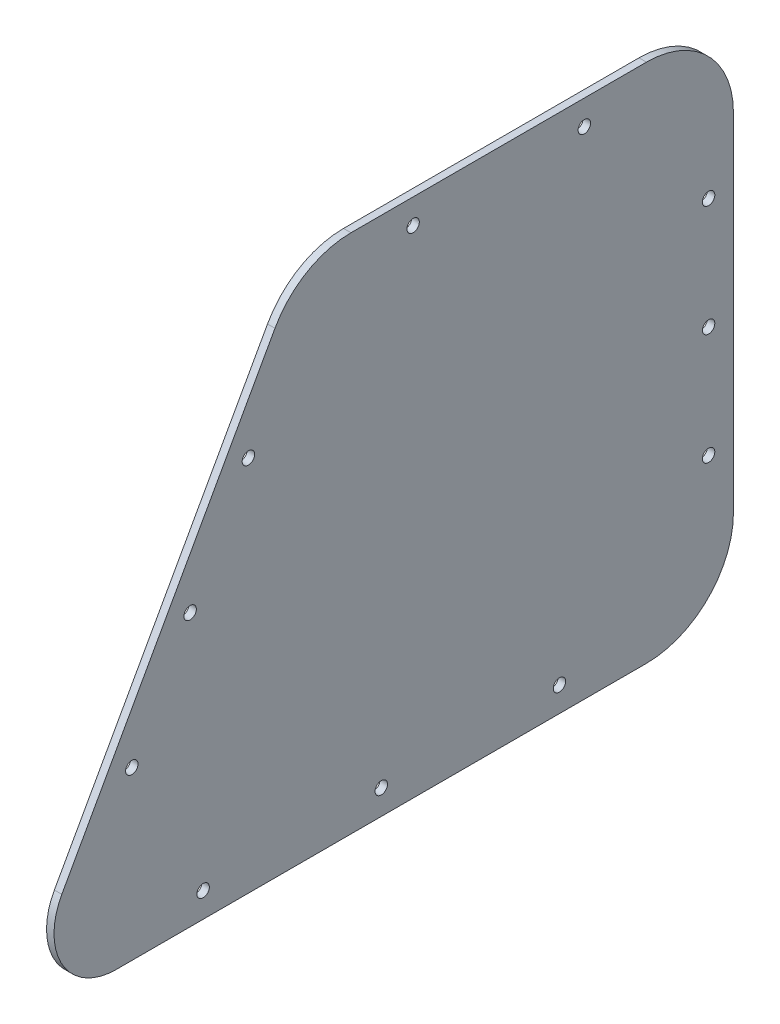
from build123d import *

# Parameters (mm, degrees)
BOSS_EXTRUDE1_DEPTH = 3
CUT_EXTRUDE1_REACH  = 242.652
SKETCH2_R           = 2.5


with BuildPart() as part:
    # Sketch1 → Boss-Extrude1 (new body)
    with BuildSketch(Plane(origin=(0, 0, 0), x_dir=(0, 0, -1), z_dir=(1, 0, 0))):
        with BuildLine():
            Line((-12.188515962, 194.5), (106.683660563, 194.5))
            ThreePointArc((106.683660563, 194.5), (131.432397904, 184.248737342), (141.683660563, 159.5))
            Line((141.683660563, 159.5), (141.683660563, 20))
            ThreePointArc((141.683660563, 20), (131.432397904, -4.748737342), (106.683660563, -15))
            Line((106.683660563, -15), (-106.683660563, -15))
            ThreePointArc((-106.683660563, -15), (-128.230433314, -2.678193247), (-128.537592466, 22.141073279))
            Line((-128.537592466, 22.141073279), (-42.784020626, 176.497502591))
            ThreePointArc((-42.784020626, 176.497502591), (-29.937986507, 189.665481852), (-12.188515962, 194.5))
        make_face()
    extrude(amount=BOSS_EXTRUDE1_DEPTH)

    # Sketch2 → Cut-Extrude1 (cut, up to next)
    with BuildSketch(Plane(origin=(3, 0, 0), x_dir=(0, 0, -1), z_dir=(1, 0, 0)), mode=Mode.PRIVATE) as cut_extrude1_sk1:
        with Locations((81.683660563, 184.5)):
            Circle(SKETCH2_R)
    cut_extrude1_tool1 = extrude(cut_extrude1_sk1.sketch, amount=-CUT_EXTRUDE1_REACH, mode=Mode.PRIVATE) & part.part
    # Sketch2 → Cut-Extrude1 (cut, up to next)
    with BuildSketch(Plane(origin=(3, 0, 0), x_dir=(0, 0, -1), z_dir=(1, 0, 0)), mode=Mode.PRIVATE) as cut_extrude1_sk2:
        with Locations((12.811484038, 184.5)):
            Circle(SKETCH2_R)
    cut_extrude1_tool2 = extrude(cut_extrude1_sk2.sketch, amount=-CUT_EXTRUDE1_REACH, mode=Mode.PRIVATE) & part.part
    # Sketch2 → Cut-Extrude1 (cut, up to next)
    with BuildSketch(Plane(origin=(3, 0, 0), x_dir=(0, 0, -1), z_dir=(1, 0, 0)), mode=Mode.PRIVATE) as cut_extrude1_sk3:
        with Locations((131.683660563, 134.49995686)):
            Circle(SKETCH2_R)
    cut_extrude1_tool3 = extrude(cut_extrude1_sk3.sketch, amount=-CUT_EXTRUDE1_REACH, mode=Mode.PRIVATE) & part.part
    # Sketch2 → Cut-Extrude1 (cut, up to next)
    with BuildSketch(Plane(origin=(3, 0, 0), x_dir=(0, 0, -1), z_dir=(1, 0, 0)), mode=Mode.PRIVATE) as cut_extrude1_sk4:
        with Locations((131.683660563, 89.75)):
            Circle(SKETCH2_R)
    cut_extrude1_tool4 = extrude(cut_extrude1_sk4.sketch, amount=-CUT_EXTRUDE1_REACH, mode=Mode.PRIVATE) & part.part
    # Sketch2 → Cut-Extrude1 (cut, up to next)
    with BuildSketch(Plane(origin=(3, 0, 0), x_dir=(0, 0, -1), z_dir=(1, 0, 0)), mode=Mode.PRIVATE) as cut_extrude1_sk5:
        with Locations((131.683660563, 44.999939605)):
            Circle(SKETCH2_R)
    cut_extrude1_tool5 = extrude(cut_extrude1_sk5.sketch, amount=-CUT_EXTRUDE1_REACH, mode=Mode.PRIVATE) & part.part
    # Sketch2 → Cut-Extrude1 (cut, up to next)
    with BuildSketch(Plane(origin=(3, 0, 0), x_dir=(0, 0, -1), z_dir=(1, 0, 0)), mode=Mode.PRIVATE) as cut_extrude1_sk6:
        with Locations((71.683660563, -5)):
            Circle(SKETCH2_R)
    cut_extrude1_tool6 = extrude(cut_extrude1_sk6.sketch, amount=-CUT_EXTRUDE1_REACH, mode=Mode.PRIVATE) & part.part
    # Sketch2 → Cut-Extrude1 (cut, up to next)
    with BuildSketch(Plane(origin=(3, 0, 0), x_dir=(0, 0, -1), z_dir=(1, 0, 0)), mode=Mode.PRIVATE) as cut_extrude1_sk7:
        with Locations((0, -5)):
            Circle(SKETCH2_R)
    cut_extrude1_tool7 = extrude(cut_extrude1_sk7.sketch, amount=-CUT_EXTRUDE1_REACH, mode=Mode.PRIVATE) & part.part
    # Sketch2 → Cut-Extrude1 (cut, up to next)
    with BuildSketch(Plane(origin=(3, 0, 0), x_dir=(0, 0, -1), z_dir=(1, 0, 0)), mode=Mode.PRIVATE) as cut_extrude1_sk8:
        with Locations((-71.683660563, -5)):
            Circle(SKETCH2_R)
    cut_extrude1_tool8 = extrude(cut_extrude1_sk8.sketch, amount=-CUT_EXTRUDE1_REACH, mode=Mode.PRIVATE) & part.part
    # Sketch2 → Cut-Extrude1 (cut, up to next)
    with BuildSketch(Plane(origin=(3, 0, 0), x_dir=(0, 0, -1), z_dir=(1, 0, 0)), mode=Mode.PRIVATE) as cut_extrude1_sk9:
        with Locations((-100.370302458, 52.250935013)):
            Circle(SKETCH2_R)
    cut_extrude1_tool9 = extrude(cut_extrude1_sk9.sketch, amount=-CUT_EXTRUDE1_REACH, mode=Mode.PRIVATE) & part.part
    # Sketch2 → Cut-Extrude1 (cut, up to next)
    with BuildSketch(Plane(origin=(3, 0, 0), x_dir=(0, 0, -1), z_dir=(1, 0, 0)), mode=Mode.PRIVATE) as cut_extrude1_sk10:
        with Locations((-76.919233785, 94.462858624)):
            Circle(SKETCH2_R)
    cut_extrude1_tool10 = extrude(cut_extrude1_sk10.sketch, amount=-CUT_EXTRUDE1_REACH, mode=Mode.PRIVATE) & part.part
    # Sketch2 → Cut-Extrude1 (cut, up to next)
    with BuildSketch(Plane(origin=(3, 0, 0), x_dir=(0, 0, -1), z_dir=(1, 0, 0)), mode=Mode.PRIVATE) as cut_extrude1_sk11:
        with Locations((-53.468165112, 136.674782235)):
            Circle(SKETCH2_R)
    cut_extrude1_tool11 = extrude(cut_extrude1_sk11.sketch, amount=-CUT_EXTRUDE1_REACH, mode=Mode.PRIVATE) & part.part
    add(cut_extrude1_tool1.solids().sort_by_distance((3, 184.5, -81.683661))[0], mode=Mode.SUBTRACT)
    add(cut_extrude1_tool2.solids().sort_by_distance((3, 184.5, -12.811484))[0], mode=Mode.SUBTRACT)
    add(cut_extrude1_tool3.solids().sort_by_distance((3, 134.499957, -131.683661))[0], mode=Mode.SUBTRACT)
    add(cut_extrude1_tool4.solids().sort_by_distance((3, 89.75, -131.683661))[0], mode=Mode.SUBTRACT)
    add(cut_extrude1_tool5.solids().sort_by_distance((3, 44.99994, -131.683661))[0], mode=Mode.SUBTRACT)
    add(cut_extrude1_tool6.solids().sort_by_distance((3, -5, -71.683661))[0], mode=Mode.SUBTRACT)
    add(cut_extrude1_tool7.solids().sort_by_distance((3, -5, 0))[0], mode=Mode.SUBTRACT)
    add(cut_extrude1_tool8.solids().sort_by_distance((3, -5, 71.683661))[0], mode=Mode.SUBTRACT)
    add(cut_extrude1_tool9.solids().sort_by_distance((3, 52.250935, 100.370302))[0], mode=Mode.SUBTRACT)
    add(cut_extrude1_tool10.solids().sort_by_distance((3, 94.462859, 76.919234))[0], mode=Mode.SUBTRACT)
    add(cut_extrude1_tool11.solids().sort_by_distance((3, 136.674782, 53.468165))[0], mode=Mode.SUBTRACT)


solid = part.part
